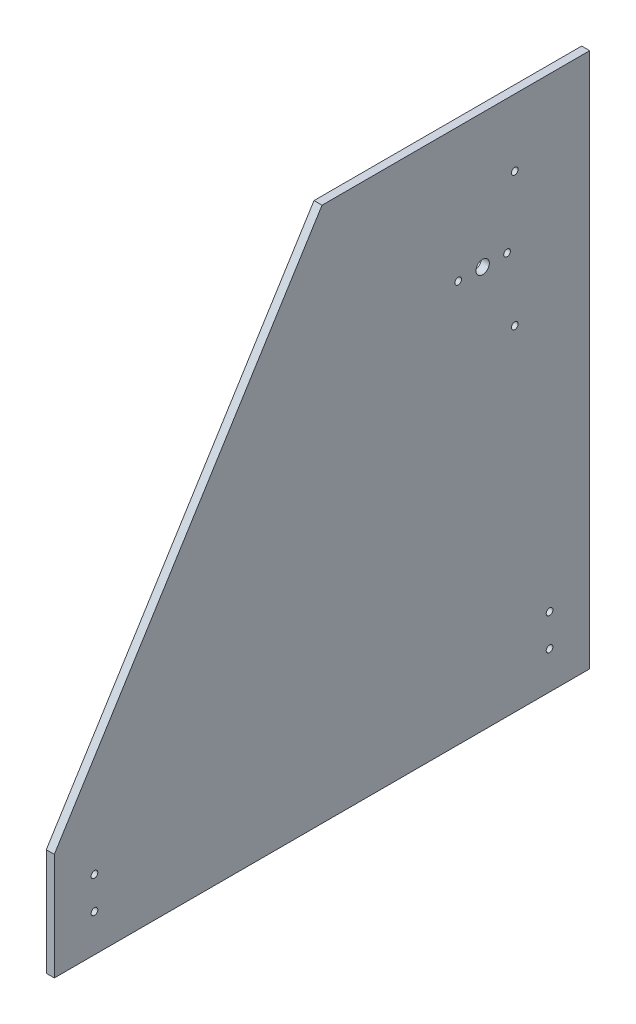
from build123d import *

# Parameters (mm, degrees)
SKETCH1_R           = 2.5
SKETCH1_R_2         = 5
BOSS_EXTRUDE1_DEPTH = 6


with BuildPart() as part:
    # Sketch1 → Boss-Extrude1 (new body)
    with BuildSketch(Plane(origin=(0, 0, 0), x_dir=(0, 0, -1), z_dir=(1, 0, 0))):
        Polygon((0, 0), (400, 0), (400, 400), (200, 400), (0, 80), align=None)
        with Locations((30, 52)):
            Circle(SKETCH1_R, mode=Mode.SUBTRACT)
        with Locations((30, 28)):
            Circle(SKETCH1_R, mode=Mode.SUBTRACT)
        with Locations((370, 28)):
            Circle(SKETCH1_R, mode=Mode.SUBTRACT)
        with Locations((370, 52)):
            Circle(SKETCH1_R, mode=Mode.SUBTRACT)
        with Locations((344, 350)):
            Circle(SKETCH1_R, mode=Mode.SUBTRACT)
        with Locations((344, 250)):
            Circle(SKETCH1_R, mode=Mode.SUBTRACT)
        with Locations((320, 300)):
            Circle(SKETCH1_R_2, mode=Mode.SUBTRACT)
        with Locations((338.25, 300)):
            Circle(SKETCH1_R, mode=Mode.SUBTRACT)
        with Locations((301.75, 300)):
            Circle(SKETCH1_R, mode=Mode.SUBTRACT)
    extrude(amount=BOSS_EXTRUDE1_DEPTH)


solid = part.part
